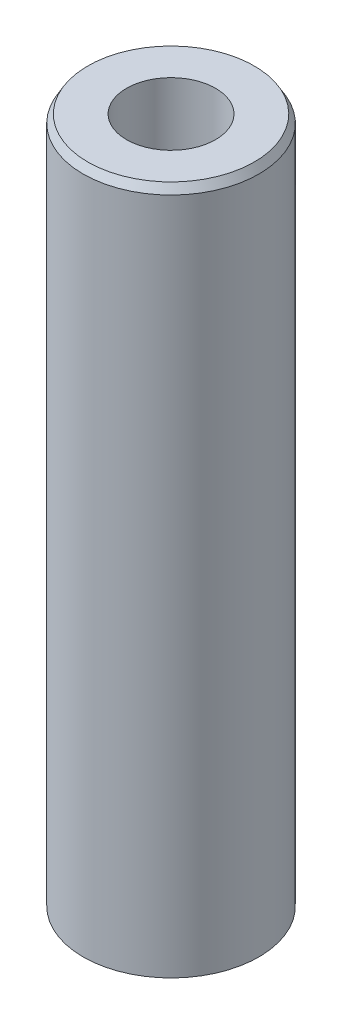
from build123d import *
from OCP.BRepFilletAPI import BRepFilletAPI_MakeChamfer

# Parameters (mm, degrees)
SKETCH1_R           = 42.5
BOSS_EXTRUDE1_DEPTH = 333.935593812
SKETCH2_R           = 21.527019467
CUT_EXTRUDE1_DEPTH  = 340.301460083
CHAMFER1_SIZE       = 3.900877513
CHAMFER1_SIZE2      = 2.252172682


with BuildPart() as part:
    # Sketch1 → Boss-Extrude1 (new body)
    with BuildSketch(Plane(origin=(0, 0, 0), x_dir=(1, 0, 0), z_dir=(0, 1, 0))):
        Circle(SKETCH1_R)
    extrude(amount=BOSS_EXTRUDE1_DEPTH)

    # Sketch2 → Cut-Extrude1 (cut, through all)
    with BuildSketch(Plane(origin=(0, 0, 0), x_dir=(1, 0, 0), z_dir=(0, 1, 0))):
        Circle(SKETCH2_R)
    extrude(amount=CUT_EXTRUDE1_DEPTH, mode=Mode.SUBTRACT)

    # Chamfer1: one chamfer whose edges measure the first distance from different faces: ONE call of the kernel's chamfer builder (chamfer() names one face for all edges)
    chamfer1_edges_1 = [part.edges().sort_by_distance(p)[0] for p in [
        (-42.5, 333.935593812, 0),
    ]]
    chamfer1_side_1 = [part.faces().sort_by_distance(p)[0] for p in [
        (-42.5, 166.967796906, 0),
    ]]
    chamfer1_edges_2 = [part.edges().sort_by_distance(p)[0] for p in [
        (-42.5, 0, 0),
    ]]
    chamfer1_side_2 = [part.faces().sort_by_distance(p)[0] for p in [
        (-41.297918472, 0, 0),
    ]]
    chamfer1 = BRepFilletAPI_MakeChamfer(part.part.solid().wrapped)
    for e in chamfer1_edges_1:
        chamfer1.Add(CHAMFER1_SIZE, CHAMFER1_SIZE2, e.wrapped, chamfer1_side_1[0].wrapped)  # the first distance lies on this face
    for e in chamfer1_edges_2:
        chamfer1.Add(CHAMFER1_SIZE, CHAMFER1_SIZE2, e.wrapped, chamfer1_side_2[0].wrapped)  # the first distance lies on this face
    add(Compound.cast(chamfer1.Shape()), mode=Mode.REPLACE)


solid = part.part
